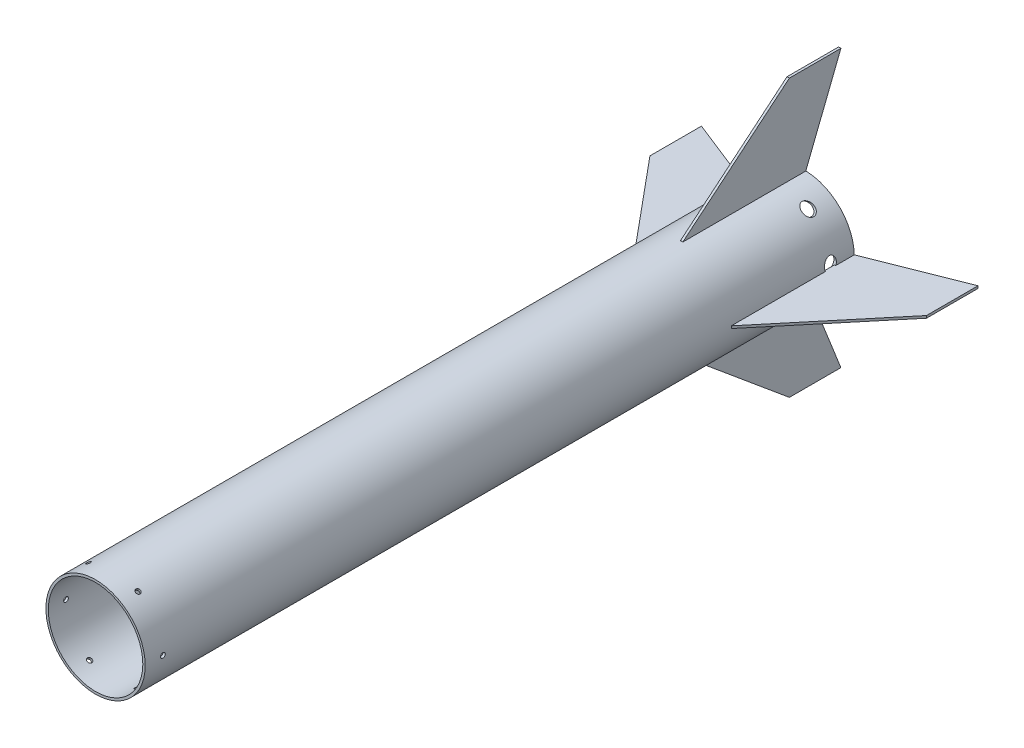
from build123d import *

# Parameters (mm, degrees)
SKETCH1_R               = 42
SKETCH1_R_2             = 40
BOSS_EXTRUDE1_DEPTH     = 600
CUT_EXTRUDE1_REACH      = 609.728
CUT_EXTRUDE1_END_RADIUS = 40
SKETCH2_R               = 2
CIRPATTERN1_COUNT       = 6
CUT_EXTRUDE2_REACH      = 609.306
CUT_EXTRUDE2_END_RADIUS = 40
SKETCH4_R               = 5
CIRPATTERN2_COUNT       = 7
BOSS_EXTRUDE6_DEPTH     = 1
CIRPATTERN3_COUNT       = 4


with BuildPart() as part:
    # Sketch1 → Boss-Extrude1 (new body)
    with BuildSketch(Plane.XY):
        Circle(SKETCH1_R)
        Circle(SKETCH1_R_2, mode=Mode.SUBTRACT)
    extrude(amount=BOSS_EXTRUDE1_DEPTH)

    # Cut-Extrude1: up to this cylinder (the profile starts outside it)
    cut_extrude1_end = Plane(origin=(0, 0, 585), z_dir=(0, 0, -1)) * Cylinder(CUT_EXTRUDE1_END_RADIUS, 1300.456, mode=Mode.PRIVATE)
    # Sketch2 → Cut-Extrude1 (cut, up to the surface)
    with BuildSketch(Plane(origin=(45, 0, 0), x_dir=(0, 0, -1), z_dir=(1, 0, 0)), mode=Mode.PRIVATE) as cut_extrude1_sk1:
        with Locations((-585, 0)):
            Circle(SKETCH2_R)
    cut_extrude1_tool1 = extrude(cut_extrude1_sk1.sketch, amount=-CUT_EXTRUDE1_REACH, mode=Mode.PRIVATE) - cut_extrude1_end
    cut_extrude1 = cut_extrude1_tool1.solids().sort_by_distance((45, 0, 585))[0]
    add(cut_extrude1, mode=Mode.SUBTRACT)

    # CirPattern1: Cut-Extrude1 ×6 about axis
    cirpattern1_axis = Axis((0, 0, 600), (0, 0, -1))
    for i in range(1, CIRPATTERN1_COUNT):
        add(cut_extrude1.rotate(cirpattern1_axis, i * 360 / CIRPATTERN1_COUNT), mode=Mode.SUBTRACT)

    # Cut-Extrude2: up to this cylinder (the profile starts outside it)
    cut_extrude2_end = Plane(origin=(0, 0, 20), z_dir=(0, 0, -1)) * Cylinder(CUT_EXTRUDE2_END_RADIUS, 1299.612, mode=Mode.PRIVATE)
    # Sketch4 → Cut-Extrude2 (cut, up to the surface)
    with BuildSketch(Plane.ZY.offset(42), mode=Mode.PRIVATE) as cut_extrude2_sk1:
        with Locations((20, -21.573561533)):
            Circle(SKETCH4_R)
    cut_extrude2_tool1 = extrude(cut_extrude2_sk1.sketch, amount=-CUT_EXTRUDE2_REACH, mode=Mode.PRIVATE) - cut_extrude2_end
    cut_extrude2 = cut_extrude2_tool1.solids().sort_by_distance((-42, -21.573562, 20))[0]
    add(cut_extrude2, mode=Mode.SUBTRACT)

    # CirPattern2: Cut-Extrude2 ×7 about axis
    cirpattern2_axis = Axis((0, 0, 600), (0, 0, -1))
    for i in range(1, CIRPATTERN2_COUNT):
        add(cut_extrude2.rotate(cirpattern2_axis, i * 360 / CIRPATTERN2_COUNT), mode=Mode.SUBTRACT)


with BuildPart() as body_2:
    # Sketch13 → Boss-Extrude6 (new, symmetric)
    with BuildSketch(Plane.ZY):
        Polygon((104, 42), (13.9, 117), (-29.7, 117), (0, 42), (0, 41), (104, 41), align=None)
    boss_extrude6 = extrude(amount=BOSS_EXTRUDE6_DEPTH, both=True)


with BuildPart() as part_1:
    add(part.part)

    # CirPattern3: Boss-Extrude6 ×4 about axis
    cirpattern3_axis = Axis((0, 0, 0), (0, 0, 1))
    for i in range(1, CIRPATTERN3_COUNT):
        add(boss_extrude6.rotate(cirpattern3_axis, i * 360 / CIRPATTERN3_COUNT))


solid = Compound([body_2.part, part_1.part])
